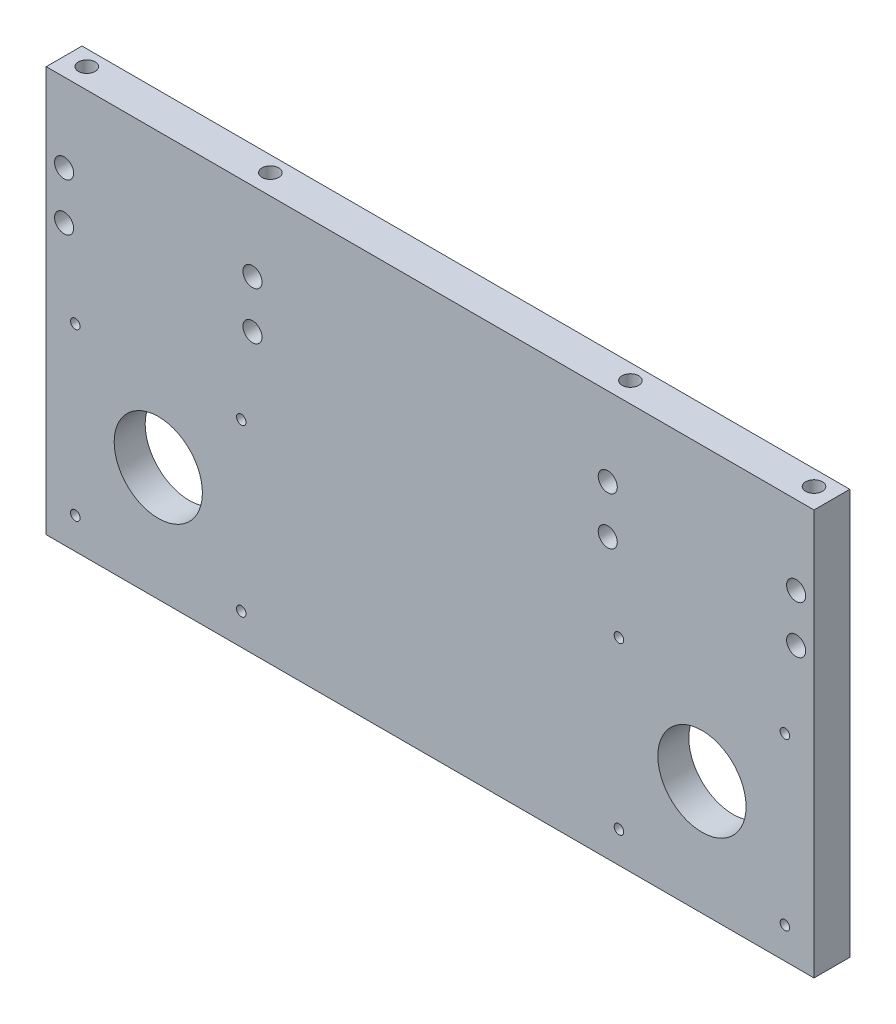
from build123d import *

# Parameters (mm, degrees)
SZKIC1_W                       = 322
SZKIC1_H                       = 170
DODANIE_WYCI_GNI_CIE1_DEPTH    = 15
SZKIC2_R                       = 2
WYTNIJ_WYCI_GNI_CIE2_DEPTH     = 17.75
SZYK_LINIOWY1_COUNT            = 2
SZYK_LINIOWY1_PITCH            = 69.6
SZYK_LINIOWY1_COUNT_DIR2       = 2
SZYK_LINIOWY1_PITCH_DIR2       = 69.6
SZKIC5_R                       = 37.5
WYTNIJ_WYCI_GNI_CIE3_DEPTH     = 2
SZKIC7_R                       = 18.5
WYTNIJ_WYCI_GNI_CIE4_DEPTH     = 17.75
SZKIC10_R                      = 4
WYTNIJ_WYCI_GNI_CIE7_DEPTH     = 183.677311125
SZYK_LINIOWY3_COUNT            = 2
SZYK_LINIOWY3_PITCH            = 79
SZYK_LINIOWY2_COUNT            = 2
SZYK_LINIOWY2_PITCH            = 228
SZYK_LINIOWY2_COPY_1_SKETCH_R  = 2
SZYK_LINIOWY2_COPY_1_DEPTH     = 17.75
SZYK_LINIOWY2_COPY_2_SKETCH_R  = 2
SZYK_LINIOWY2_COPY_2_DEPTH     = 17.75
SZYK_LINIOWY2_COPY_3_SKETCH_R  = 2
SZYK_LINIOWY2_COPY_3_DEPTH     = 17.75
SZYK_LINIOWY2_COPY_4_SKETCH_R  = 4
SZYK_LINIOWY2_COPY_4_DEPTH     = 183.677311125
SZYK_LINIOWY2_COPY_5_SKETCH_R  = 4
SZYK_LINIOWY2_COPY_5_DEPTH     = 183.677311125
OTW_R_GWINTOWANY_M8X1_01_D     = 7
OTW_R_GWINTOWANY_M8X1_01_DEPTH = 21
OTW_R_GWINTOWANY_M8X1_01_TIP   = 2.103012167


with BuildPart() as part:
    # Szkic1 → Dodanie-wyciągnięcie1 (new body)
    with BuildSketch(Plane.XY):
        Rectangle(SZKIC1_W, SZKIC1_H)
    extrude(amount=DODANIE_WYCI_GNI_CIE1_DEPTH)

    # Szkic2 → Wytnij-wyciągnięcie2 (cut)
    with BuildSketch(Plane.XY.offset(15)):
        with Locations((-148.8, -71.87)):
            Circle(SZKIC2_R)
    wytnij_wyci_gni_cie2 = extrude(amount=-WYTNIJ_WYCI_GNI_CIE2_DEPTH, mode=Mode.SUBTRACT)

    # Szyk liniowy1: Wytnij-wyci_gni_cie2 2 × 2
    with Locations(*[(i * SZYK_LINIOWY1_PITCH, j * SZYK_LINIOWY1_PITCH_DIR2, 0) for i in range(SZYK_LINIOWY1_COUNT) for j in range(SZYK_LINIOWY1_COUNT_DIR2) if (i, j) != (0, 0)]):
        add(wytnij_wyci_gni_cie2, mode=Mode.SUBTRACT)

    # Szkic5 → Wytnij-wyciągnięcie3 (cut)
    with BuildSketch(Plane(origin=(0, 0, 0), x_dir=(-1, 0, 0), z_dir=(0, 0, -1))):
        with Locations((114, -37.07)):
            Circle(SZKIC5_R)
    wytnij_wyci_gni_cie3 = extrude(amount=-WYTNIJ_WYCI_GNI_CIE3_DEPTH, mode=Mode.SUBTRACT)

    # Szkic7 → Wytnij-wyciągnięcie4 (cut)
    with BuildSketch(Plane(origin=(0, 0, 2), x_dir=(-1, 0, 0), z_dir=(0, 0, -1))):
        with Locations((114, -37.07)):
            Circle(SZKIC7_R)
    wytnij_wyci_gni_cie4 = extrude(amount=-WYTNIJ_WYCI_GNI_CIE4_DEPTH, mode=Mode.SUBTRACT)

    # Szkic10 → Wytnij-wyciągnięcie7 (cut, through all)
    with BuildSketch(Plane.XY.offset(15)):
        with Locations((-153.5, 52)):
            Circle(SZKIC10_R)
        with Locations((-153.5, 32)):
            Circle(SZKIC10_R)
    wytnij_wyci_gni_cie7 = extrude(amount=-WYTNIJ_WYCI_GNI_CIE7_DEPTH, mode=Mode.SUBTRACT)

    # Szyk liniowy3: Wytnij-wyciągnięcie7 ×2
    with Locations(*[(i * SZYK_LINIOWY3_PITCH, 0, 0) for i in range(1, SZYK_LINIOWY3_COUNT)]):
        add(wytnij_wyci_gni_cie7, mode=Mode.SUBTRACT)

    # Szyk liniowy2: Wytnij-wyciągnięcie2, Wytnij-wyciągnięcie3, Wytnij-wyciągnięcie4 ×2
    with Locations(*[(i * SZYK_LINIOWY2_PITCH, 0, 0) for i in range(1, SZYK_LINIOWY2_COUNT)]):
        add(wytnij_wyci_gni_cie2, mode=Mode.SUBTRACT)
        add(wytnij_wyci_gni_cie3, mode=Mode.SUBTRACT)
        add(wytnij_wyci_gni_cie4, mode=Mode.SUBTRACT)

    # Szyk liniowy2 copy 1 sketch → Szyk liniowy2 copy 1 (cut)
    with BuildSketch(Plane(origin=(228, 69.6, 15), x_dir=(1, 0, 0), z_dir=(0, 0, 1))):
        with Locations((-148.8, -71.87)):
            Circle(SZYK_LINIOWY2_COPY_1_SKETCH_R)
    extrude(amount=-SZYK_LINIOWY2_COPY_1_DEPTH, mode=Mode.SUBTRACT)

    # Szyk liniowy2 copy 2 sketch → Szyk liniowy2 copy 2 (cut)
    with BuildSketch(Plane(origin=(297.6, 0, 15), x_dir=(1, 0, 0), z_dir=(0, 0, 1))):
        with Locations((-148.8, -71.87)):
            Circle(SZYK_LINIOWY2_COPY_2_SKETCH_R)
    extrude(amount=-SZYK_LINIOWY2_COPY_2_DEPTH, mode=Mode.SUBTRACT)

    # Szyk liniowy2 copy 3 sketch → Szyk liniowy2 copy 3 (cut)
    with BuildSketch(Plane(origin=(297.6, 69.6, 15), x_dir=(1, 0, 0), z_dir=(0, 0, 1))):
        with Locations((-148.8, -71.87)):
            Circle(SZYK_LINIOWY2_COPY_3_SKETCH_R)
    extrude(amount=-SZYK_LINIOWY2_COPY_3_DEPTH, mode=Mode.SUBTRACT)

    # Szyk liniowy2 copy 4 sketch → Szyk liniowy2 copy 4 (cut, through all)
    with BuildSketch(Plane(origin=(307, 0, 15), x_dir=(1, 0, 0), z_dir=(0, 0, 1))):
        with Locations((-153.5, 52)):
            Circle(SZYK_LINIOWY2_COPY_4_SKETCH_R)
        with Locations((-153.5, 32)):
            Circle(SZYK_LINIOWY2_COPY_4_SKETCH_R)
    extrude(amount=-SZYK_LINIOWY2_COPY_4_DEPTH, mode=Mode.SUBTRACT)

    # Szyk liniowy2 copy 5 sketch → Szyk liniowy2 copy 5 (cut, through all)
    with BuildSketch(Plane(origin=(228, 0, 15), x_dir=(1, 0, 0), z_dir=(0, 0, 1))):
        with Locations((-153.5, 52)):
            Circle(SZYK_LINIOWY2_COPY_5_SKETCH_R)
        with Locations((-153.5, 32)):
            Circle(SZYK_LINIOWY2_COPY_5_SKETCH_R)
    extrude(amount=-SZYK_LINIOWY2_COPY_5_DEPTH, mode=Mode.SUBTRACT)

    # Otwór gwintowany M8x1.01
    with Locations(Plane(origin=(0, 85, 0), x_dir=(1, 0, 0), z_dir=(0, 1, 0))):
        with Locations((-152.5, -6.5), (-75.5, -6.5), (75.5, -6.5), (152.5, -6.5)):
            Hole(OTW_R_GWINTOWANY_M8X1_01_D / 2, depth=OTW_R_GWINTOWANY_M8X1_01_DEPTH)
            with Locations((0, 0, -(OTW_R_GWINTOWANY_M8X1_01_DEPTH + OTW_R_GWINTOWANY_M8X1_01_TIP / 2))):  # 118° drill point
                Cone(0, OTW_R_GWINTOWANY_M8X1_01_D / 2, OTW_R_GWINTOWANY_M8X1_01_TIP, mode=Mode.SUBTRACT)


solid = part.part
